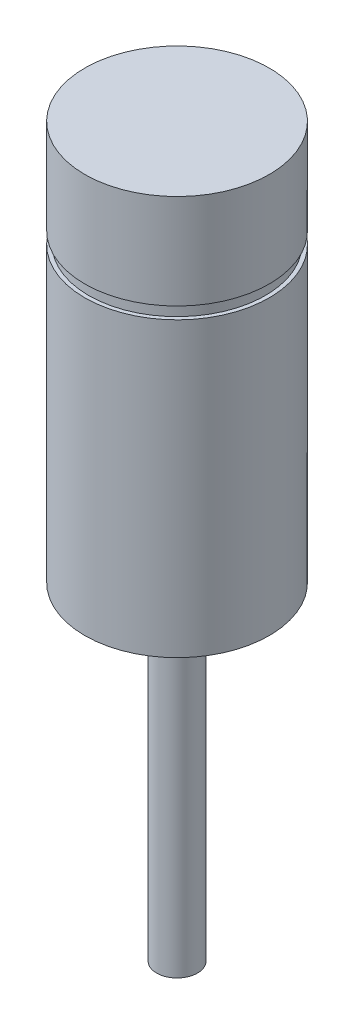
from build123d import *


with BuildPart() as part:
    # Sketch2 → Revolve1 (revolve)
    with BuildSketch(Plane(origin=(0, 0, 0), x_dir=(0, 0, -1), z_dir=(1, 0, 0))):
        Polygon((0, 0), (2, 0), (2, 27.94), (6.7945, 32.0802), (9.017, 32.0802), (9.017, 60.6806), (8.636, 60.6806), (8.636, 61.849), (9.017, 61.849), (9.017, 71.12), (0, 71.12), align=None)
    revolve(axis=Axis((0, 71.12, 0), (0, -1, 0)))


solid = part.part
